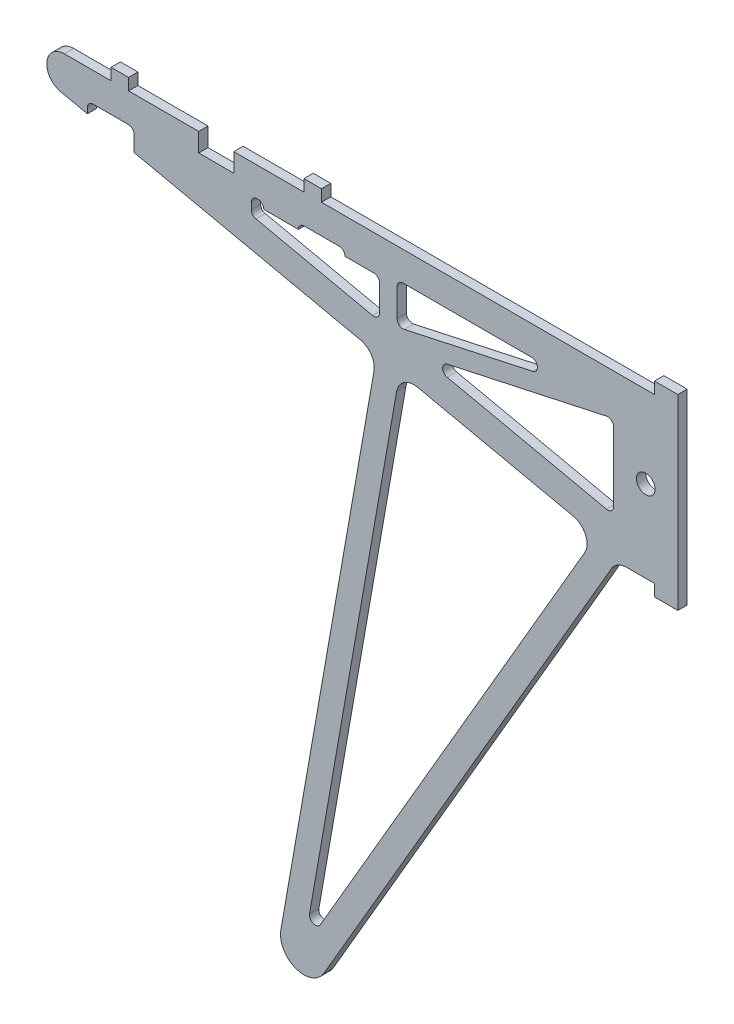
from build123d import *

# Parameters (mm, degrees)
BOSS_EXTRUDE1_DEPTH = 1.6
CUT_EXTRUDE1_REACH  = 134.452
SKETCH3_W           = 5.911971619
SKETCH3_H           = 1
BOSS_EXTRUDE2_DEPTH = 1.6
BOSS_EXTRUDE3_DEPTH = 1.6
FILLET2_R           = 1
SKETCH6_R           = 1.6
CUT_EXTRUDE2_DEPTH  = 133.452104551
BOSS_EXTRUDE4_DEPTH = 1.6
FILLET3_R           = 3


with BuildPart() as part:
    # Sketch1 → Boss-Extrude1 (new body)
    with BuildSketch(Plane.XY):
        with BuildLine():
            Line((-25, 2), (-25, 0))
            Line((-25, 0), (-82, 0))
            Line((-82, 0), (-82, 2))
            Line((-82, 2), (-85, 2))
            Line((-85, 2), (-85, 0))
            Line((-85, 0), (-97, 0))
            Line((-97, 0), (-97, -3.2))
            Line((-97, -3.2), (-103, -3.2))
            Line((-103, -3.2), (-103, 0))
            Line((-103, 0), (-115, 0))
            Line((-115, 0), (-115, 2))
            Line((-115, 2), (-118, 2))
            Line((-118, 2), (-118, 0))
            Line((-118, 0), (-126, 0))
            ThreePointArc((-126, 0), (-128.982873168, -2.679894289), (-126.636556491, -5.931688223))
            Line((-126.636556491, -5.931688223), (-25, -28))
            Line((-25, -28), (-25, -30))
            Line((-25, -30), (-21, -30))
            Line((-21, -30), (-21, 2))
            Line((-21, 2), (-25, 2))
        make_face()
        Polygon((-32, -21.363586453), (-64.968742205, -14.205094401), (-32, -7.046602348), align=None, mode=Mode.SUBTRACT)
        Polygon((-69.038028381, -5), (-36.712857451, -5), (-69.038028381, -12.018753635), align=None, mode=Mode.SUBTRACT)
        Polygon((-72.038028381, -5), (-72.038028381, -12.67014264), (-107.363199311, -5), align=None, mode=Mode.SUBTRACT)
    extrude(amount=BOSS_EXTRUDE1_DEPTH)

    # Sketch2 → Cut-Extrude1 (cut, up to next)
    with BuildSketch(Plane.XY.offset(1.6), mode=Mode.PRIVATE) as cut_extrude1_sk1:
        Polygon((-122.05, -5), (-114.05, -5), (-114.05, -8.664603056), (-122.05, -6.927565711), align=None)
    cut_extrude1_tool1 = extrude(cut_extrude1_sk1.sketch, amount=-CUT_EXTRUDE1_REACH, mode=Mode.PRIVATE) & part.part
    add(cut_extrude1_tool1.solids().sort_by_distance((-117.635841, -6.443005, 1.6))[0], mode=Mode.SUBTRACT)

    # Sketch3 → Boss-Extrude2 (add)
    with BuildSketch(Plane.XY.offset(1.6)):
        with Locations((-74.99401419, -5.5)):
            Rectangle(SKETCH3_W, SKETCH3_H)
        with Locations((-88.90598581, -5.5)):
            Rectangle(SKETCH3_W, SKETCH3_H)
    extrude(amount=-BOSS_EXTRUDE2_DEPTH)

    # Sketch4 → Boss-Extrude3 (add)
    with BuildSketch(Plane.XY.offset(1.6)):
        Polygon((-107.363199311, -5), (-94, -5), (-94, -7.901547031), align=None)
    extrude(amount=-BOSS_EXTRUDE3_DEPTH)

    # Fillet2
    fillet2_edges = [part.edges().sort_by_distance(p)[0] for p in [
        (-64.968742205, -14.205094401, 0.8),
        (-69.038028381, -12.018753635, 0.8),
        (-72.038028381, -12.67014264, 0.8),
        (-69.038028381, -5, 0.8),
        (-36.712857451, -5, 0.8),
        (-32, -7.046602348, 0.8),
        (-32, -21.363586453, 0.8),
        (-122.05, -5, 0.8),
        (-114.05, -5, 0.8),
        (-85.95, -5, 0.8),
        (-77.95, -5, 0.8),
        (-72.038028381, -6, 0.8),
        (-91.861971619, -5, 0.8),
        (-94, -7.901547031, 0.8),
        (-94, -5, 0.8),
    ]]
    fillet(fillet2_edges, radius=FILLET2_R - 0.0001)  # a hair under: the kernel refuses the full size

    # Sketch6 → Cut-Extrude2 (cut, through all)
    with BuildSketch(Plane.XY.offset(1.6)):
        with Locations((-26.5, -14)):
            Circle(SKETCH6_R)
    extrude(amount=-CUT_EXTRUDE2_DEPTH, mode=Mode.SUBTRACT)

    # Sketch5 → Boss-Extrude4 (add)
    with BuildSketch(Plane.XY.offset(1.6)):
        with BuildLine():
            Line((-72.502917062, -17.685707385), (-88.939743507, -111.308320091))
            ThreePointArc((-88.939743507, -111.308320091), (-86.37296732, -115.756988254), (-81.542598068, -114.011559564))
            Line((-81.542598068, -114.011559564), (-31.5, -28))
            Line((-31.5, -28), (-25, -28))
            Line((-25, -28), (-34.87966647, -25.854831299))
            Line((-34.87966647, -25.854831299), (-82.18159936, -107.155826358))
            ThreePointArc((-82.18159936, -107.155826358), (-83.389191673, -107.59218353), (-84.03088572, -106.48001649))
            Line((-84.03088572, -106.48001649), (-68.590867503, -18.535129407))
            Line((-68.590867503, -18.535129407), (-72.502917062, -17.685707385))
        make_face()
    extrude(amount=-BOSS_EXTRUDE4_DEPTH)

    # Fillet3
    fillet3_edges = [part.edges().sort_by_distance(p)[0] for p in [
        (-72.502917062, -17.685707385, 0.8),
        (-68.590867503, -18.535129407, 0.8),
        (-34.87966647, -25.854831299, 0.8),
        (-31.5, -28, 0.8),
    ]]
    fillet(fillet3_edges, radius=FILLET3_R)


solid = part.part
